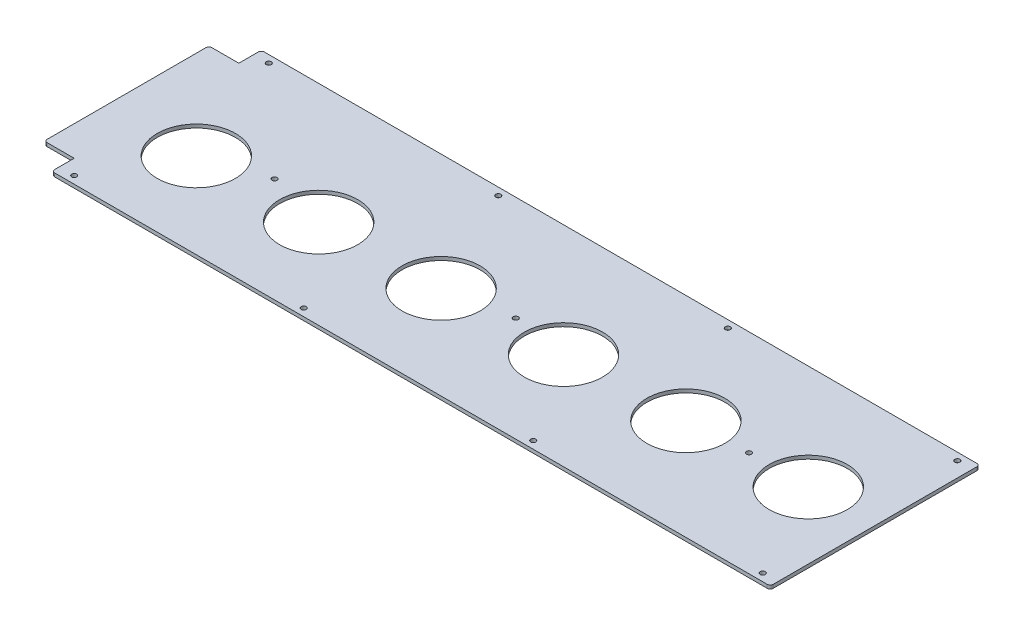
from build123d import *

# Parameters (mm, degrees)
SKETCH1_R             = 33.147
BOSS_EXTRUDE1_DEPTH   = 2.9718
F_8_CLEARANCE_HOLE1_D = 4.3053
FILLET1_R             = 2.54


with BuildPart() as part:
    # Sketch1 → Boss-Extrude1 (new body)
    with BuildSketch(Plane(origin=(0, 0, 0), x_dir=(1, 0, 0), z_dir=(0, 1, 0))):
        Polygon((720.939652548, 26.242162499), (720.939652548, -113.457837501), (746.339652548, -113.457837501), (746.339652548, -132.507837501), (1355.939652548, -132.507837501), (1355.939652548, 45.292162499), (746.339652548, 45.292162499), (746.339652548, 26.242162499), align=None)
        with Locations((1299.335652548, -43.607837501)):
            Circle(SKETCH1_R, mode=Mode.SUBTRACT)
        with Locations((1198.753704418, -46.868923427)):
            Circle(SKETCH1_R, mode=Mode.SUBTRACT)
        with Locations((1098.171756288, -50.130009353)):
            Circle(SKETCH1_R, mode=Mode.SUBTRACT)
        with Locations((997.589808158, -53.391095279)):
            Circle(SKETCH1_R, mode=Mode.SUBTRACT)
        with Locations((897.007860028, -56.652181206)):
            Circle(SKETCH1_R, mode=Mode.SUBTRACT)
        with Locations((796.425911898, -59.913267132)):
            Circle(SKETCH1_R, mode=Mode.SUBTRACT)
    extrude(amount=BOSS_EXTRUDE1_DEPTH)

    # #8 Clearance Hole1 (through all)
    with Locations(Plane(origin=(0, 2.9718, 0), x_dir=(1, 0, 0), z_dir=(0, 1, 0))):
        with Locations((759.039652548, 38.942162499), (759.039652548, -126.157837501), (953.772985881, -126.157837501), (953.772985881, 38.942162499), (1148.506319214, 38.942162499), (1148.506319214, -126.157837501), (1343.239652548, -126.157837501), (1343.239652548, 38.942162499), (1249.018252548, -43.607837501), (1051.139652548, -43.607837501), (846.479052548, -43.607837501)):
            Hole(F_8_CLEARANCE_HOLE1_D / 2)

    # Fillet1
    fillet1_edges = [part.edges().sort_by_distance(p)[0] for p in [
        (720.939652548, 1.4859, 113.457837501),
        (720.939652548, 1.4859, -26.242162499),
        (746.339652548, 1.4859, -45.292162499),
        (746.339652548, 1.4859, 132.507837501),
        (1355.939652548, 1.4859, 132.507837501),
        (1355.939652548, 1.4859, -45.292162499),
    ]]
    fillet(fillet1_edges, radius=FILLET1_R)


solid = part.part
